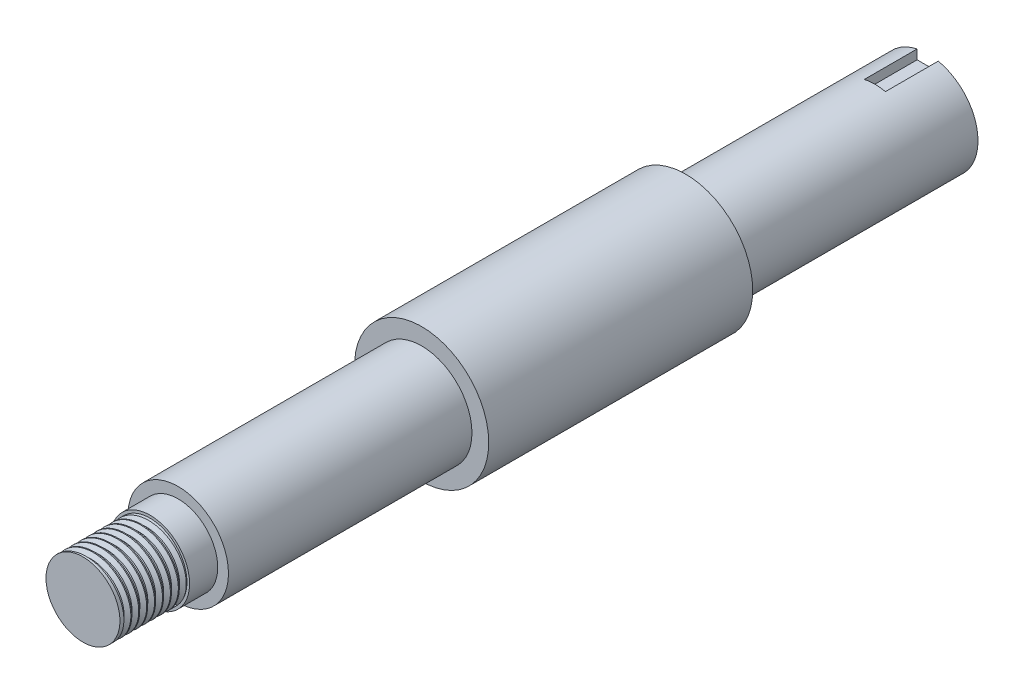
from build123d import *

# Parameters (mm, degrees)
CHUCK_THREAD_PITCH = 1.5
SKETCH_KEY_W       = 4
SKETCH_KEY_H       = 2
KEY_CUT_DEPTH      = 10


with BuildPart() as part:
    # Sketch Spindle Skeleton one side → Revolve Spindle (revolve)
    with BuildSketch(Plane(origin=(0, 0, 0), x_dir=(0, 0, -1), z_dir=(1, 0, 0)), mode=Mode.PRIVATE) as revolve_spindle_sk:
        Polygon((-160.00000004, 7), (-160.00000004, 0), (0, 0), (0, 9.525), (-45.847, 9.525), (-45.847, 12.7), (-95.847000076, 12.7), (-95.847000076, 9.525), (-141.96600004, 9.525), (-141.96600004, 7.493), (-147.30000004, 7.493), (-147.30000004, 7), align=None)
    revolve(revolve_spindle_sk.sketch.rotate(Axis((0, 0, 1000), (0, 0, -1)), 90), axis=Axis((0, 0, 1000), (0, 0, -1)))

    # Chuck Thread: the profile of Thread Profile2 profile screwed along a right-hand helix of 7.62 turns, 8 arcs to a turn; built about Z, then put on its axis
    chuck_thread_z = Axis((0, 0, 0), (0, 0, 1))
    chuck_thread_corners = [(7.0003, 0, -0.000173205), (7.0003, 0, 1.312673201), (6.188101187, 0, 0.843749998), (6.188101187, 0, 0.468749998)]
    with BuildLine(mode=Mode.PRIVATE) as chuck_thread_profile:
        Line(chuck_thread_corners[0], chuck_thread_corners[1])
        Line(chuck_thread_corners[1], chuck_thread_corners[2])
        Line(chuck_thread_corners[2], chuck_thread_corners[3])
        Line(chuck_thread_corners[3], chuck_thread_corners[0])
    chuck_thread_cap = Face(chuck_thread_profile.wire())
    chuck_thread_turn_angles = [0, 22.5, 45, 67.5, 90, 112.5, 135, 157.5, 180, 202.5, 225, 247.5, 270, 292.5, 315, 337.5, 360]
    chuck_thread_turn_weights = [1, 0.9238795325112867, 1, 0.9238795325112867, 1, 0.9238795325112867, 1, 0.9238795325112867, 1, 0.9238795325112867, 1, 0.9238795325112867, 1, 0.9238795325112867, 1, 0.9238795325112867, 1]
    chuck_thread_turn_rails = [Edge.make_bspline([Vector(p[0], p[1], 0).rotate(chuck_thread_z, chuck_thread_turn_angles[k]) / chuck_thread_turn_weights[k] + Vector(0, 0, p[2] + CHUCK_THREAD_PITCH * chuck_thread_turn_angles[k] / 360) for k in range(17)], [0, 0, 0, 1, 1, 2, 2, 3, 3, 4, 4, 5, 5, 6, 6, 7, 7, 8, 8, 8], 2, chuck_thread_turn_weights) for p in chuck_thread_corners]
    chuck_thread_turn_sides = [Face.make_surface_from_curves(chuck_thread_turn_rails[p[0]], chuck_thread_turn_rails[p[1]]) for p in [(0, 1), (1, 2), (2, 3), (3, 0)]]
    chuck_thread_last_angles = [2520, 2542.5, 2565, 2587.5, 2610, 2632.5, 2655, 2677.5, 2700, 2721.6, 2743.2]
    chuck_thread_last_weights = [1, 0.9238795325112867, 1, 0.9238795325112867, 1, 0.9238795325112867, 1, 0.9238795325112867, 1, 0.929776485888252, 1]
    chuck_thread_last_rails = [Edge.make_bspline([Vector(p[0], p[1], 0).rotate(chuck_thread_z, chuck_thread_last_angles[k]) / chuck_thread_last_weights[k] + Vector(0, 0, p[2] + CHUCK_THREAD_PITCH * chuck_thread_last_angles[k] / 360) for k in range(11)], [0, 0, 0, 1, 1, 2, 2, 3, 3, 4, 4, 5, 5, 5], 2, chuck_thread_last_weights) for p in chuck_thread_corners]
    chuck_thread_last_sides = [Face.make_surface_from_curves(chuck_thread_last_rails[p[0]], chuck_thread_last_rails[p[1]]) for p in [(0, 1), (1, 2), (2, 3), (3, 0)]]
    chuck_thread = Plane(origin=(0, 0, 160.00000004), x_dir=(-1, 0, 0), z_dir=(0, 0, -1)) * Solid(Shell([*[p.moved(Location((0, 0, CHUCK_THREAD_PITCH * i))) for i in range(7) for p in chuck_thread_turn_sides], *chuck_thread_last_sides, chuck_thread_cap, chuck_thread_cap.rotate(chuck_thread_z, 2743.2).moved(Location((0, 0, CHUCK_THREAD_PITCH * 2743.2 / 360)))]))
    add(chuck_thread, mode=Mode.SUBTRACT)

    # Sketch Key → Key Cut (cut)
    with BuildSketch(Plane(origin=(0, 0, 0), x_dir=(-1, 0, 0), z_dir=(0, 0, -1))):
        with Locations((0, 8.525)):
            Rectangle(SKETCH_KEY_W, SKETCH_KEY_H)
    extrude(amount=-KEY_CUT_DEPTH, mode=Mode.SUBTRACT)


solid = part.part
